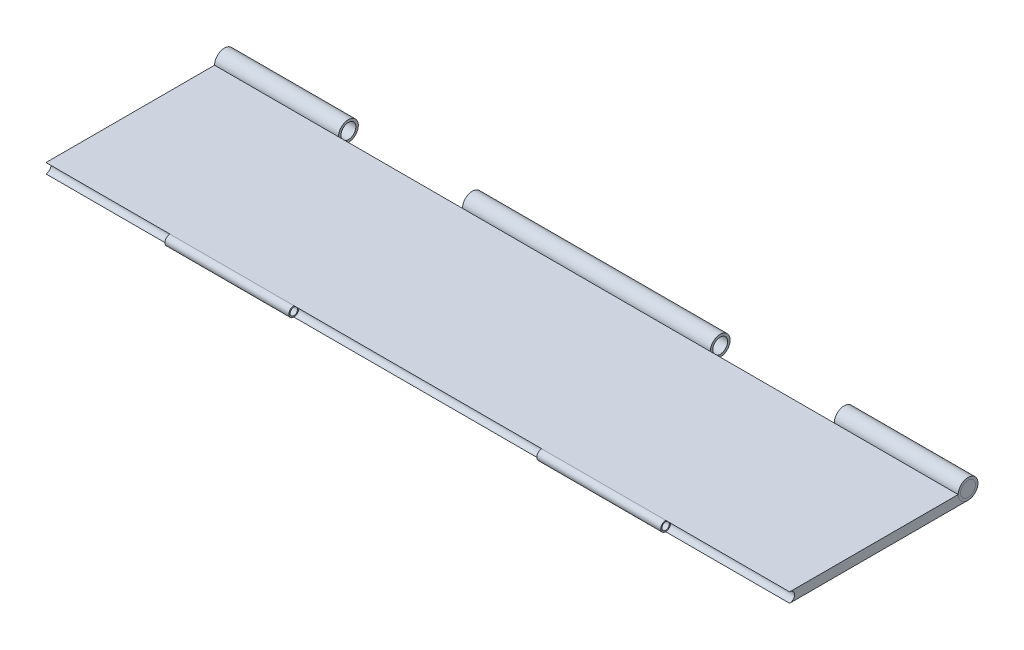
from build123d import *

# Parameters (mm, degrees)
SKETCH_1_W                   = 300
SKETCH_1_H                   = 72
EXTRUDE_1_DEPTH              = 4
SKETCH_2_R                   = 4
CUT_EXTRUDE_1_DEPTH          = 300
SKETCH_3_R                   = 4
SKETCH_3_R_2                 = 3
EXTRUDE_1_2_DEPTH            = 300
SKETCH_5_R                   = 3
EXTRUDE_2_DEPTH              = 5
SKETCH_6_R                   = 3
EXTRUDE_3_DEPTH              = 5
SPLIT_START                  = -101.97740113
SPLIT_BODIES_1_OUTLINE_R     = 4
SPLIT_BODIES_1_OUTLINE_R_2   = 3
SPLIT_BODIES_1_DEPTH         = 50
SPLIT_START_2                = 48.02259887
SPLIT_BODIES_1_2_OUTLINE_R   = 4
SPLIT_BODIES_1_2_OUTLINE_R_2 = 3
SPLIT_BODIES_1_2_DEPTH       = 50
SKETCH_7_R                   = 2
CUT_EXTRUDE_2_DEPTH          = 309.175133319
EXTRUDE_START                = 50
SKETCH_8_R                   = 2
SKETCH_8_R_2                 = 1.5
EXTRUDE_3_2_DEPTH            = 50
SKETCH_10_R                  = 2
SKETCH_10_R_2                = 1.5
EXTRUDE_4_DEPTH              = 50


# Read off the part's stored shape, not the designer's step: 分割1
with BuildPart() as part:
    # 草图1 → Extrude 1 (new body)
    with BuildSketch(Plane(origin=(0, 0, 0), x_dir=(1, 0, 0), z_dir=(0, 1, 0))):
        with Locations((-1.97740113, -34.056497175)):
            Rectangle(SKETCH_1_W, SKETCH_1_H)
    extrude(amount=EXTRUDE_1_DEPTH)

    # 草图2 → 切除-拉伸1 (cut)
    with BuildSketch(Plane(origin=(148.02259887, 0, 0), x_dir=(0, 0, -1), z_dir=(1, 0, 0))):
        with Locations((1.943502825, 4)):
            Circle(SKETCH_2_R)
    extrude(amount=-CUT_EXTRUDE_1_DEPTH, mode=Mode.SUBTRACT)

    # 草图7 → 切除-拉伸2 (cut, through all)
    with BuildSketch(Plane(origin=(148.02259887, 0, 0), x_dir=(0, 0, -1), z_dir=(1, 0, 0))):
        with Locations((-70.056497175, 2)):
            Circle(SKETCH_7_R)
    extrude(amount=-CUT_EXTRUDE_2_DEPTH, mode=Mode.SUBTRACT)

    # 草图8 → Extrude 3 2 (add)
    with BuildSketch(Plane(origin=(-101.97740113, 0, 0), x_dir=(0, 0, -1), z_dir=(1, 0, 0)).offset(EXTRUDE_START)):
        with Locations((-70.056497175, 2)):
            Circle(SKETCH_8_R)
        with Locations((-70.056497175, 2)):
            Circle(SKETCH_8_R_2, mode=Mode.SUBTRACT)
    extrude(amount=-EXTRUDE_3_2_DEPTH)

    # 草图10 → 拉伸-薄壁4 (add)
    with BuildSketch(Plane(origin=(98.02259887, 0, 0), x_dir=(0, 0, -1), z_dir=(1, 0, 0))):
        with Locations((-70.056497175, 2)):
            Circle(SKETCH_10_R)
        with Locations((-70.056497175, 2)):
            Circle(SKETCH_10_R_2, mode=Mode.SUBTRACT)
    extrude(amount=-EXTRUDE_4_DEPTH)


with BuildPart() as body_2:
    # 草图3 → Extrude 1 2 (new body)
    with BuildSketch(Plane(origin=(148.02259887, 0, 0), x_dir=(0, 0, -1), z_dir=(1, 0, 0))):
        with Locations((1.943502825, 4)):
            Circle(SKETCH_3_R)
        with Locations((1.943502825, 4)):
            Circle(SKETCH_3_R_2, mode=Mode.SUBTRACT)
    extrude(amount=-EXTRUDE_1_2_DEPTH)

    # Split Bodies 1 outline → Split Bodies 1 (cut)
    with BuildSketch(Plane.YZ.offset(SPLIT_START)):
        with Locations((4, -1.943502825)):
            Circle(SPLIT_BODIES_1_OUTLINE_R)
        with Locations((4, -1.943502825)):
            Circle(SPLIT_BODIES_1_OUTLINE_R_2, mode=Mode.SUBTRACT)
    extrude(amount=SPLIT_BODIES_1_DEPTH, mode=Mode.SUBTRACT)

    # Split Bodies 1 2 outline → Split Bodies 1 2 (cut)
    with BuildSketch(Plane.YZ.offset(SPLIT_START_2)):
        with Locations((4, -1.943502825)):
            Circle(SPLIT_BODIES_1_2_OUTLINE_R)
        with Locations((4, -1.943502825)):
            Circle(SPLIT_BODIES_1_2_OUTLINE_R_2, mode=Mode.SUBTRACT)
    extrude(amount=SPLIT_BODIES_1_2_DEPTH, mode=Mode.SUBTRACT)


with BuildPart() as body_3:
    # 草图5 → 凸台-拉伸2 (new body)
    with BuildSketch(Plane(origin=(148.02259887, 0, 0), x_dir=(0, 0, -1), z_dir=(1, 0, 0))):
        with Locations((1.943502825, 4)):
            Circle(SKETCH_5_R)
    extrude(amount=-EXTRUDE_2_DEPTH)


with BuildPart() as body_4:
    # 草图6 → Extrude 3 (new body)
    with BuildSketch(Plane.ZY.offset(151.97740113)):
        with Locations((-1.943502825, 4)):
            Circle(SKETCH_6_R)
    extrude(amount=-EXTRUDE_3_DEPTH)


solid = Compound([part.part, body_2.part, body_3.part, body_4.part])
